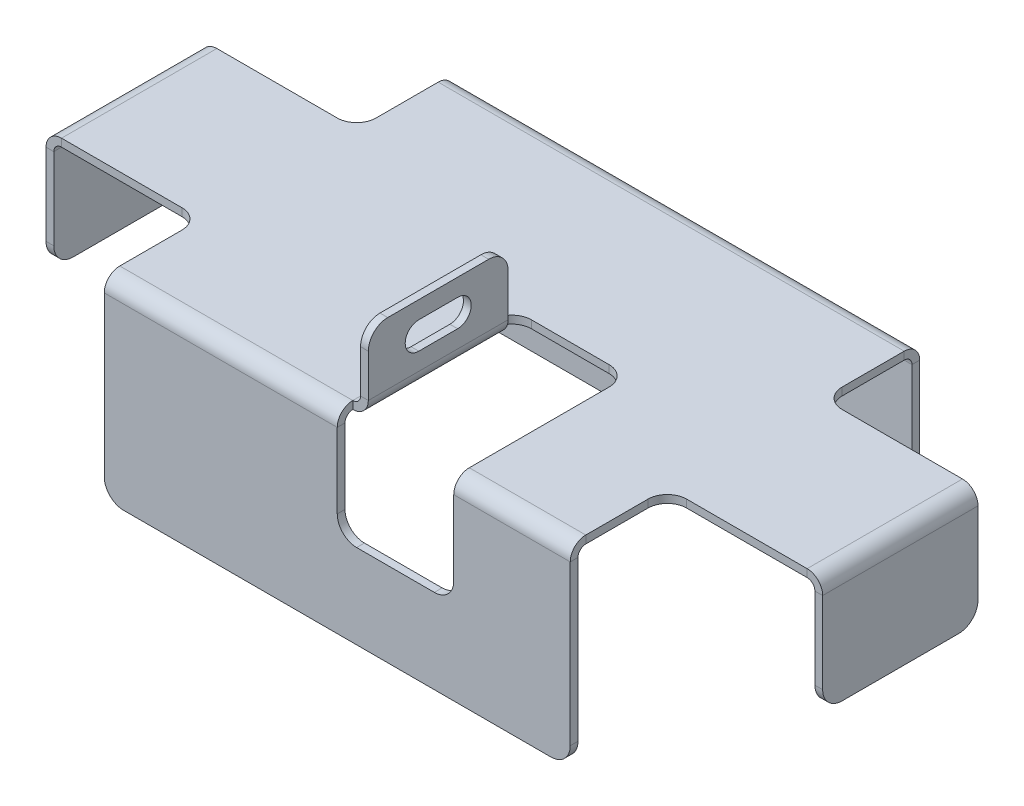
from build123d import *

# Parameters (mm, degrees)
BASE_FLANGE1_DEPTH      = 45
EDGE_FLANGE2_START      = -100
EDGE_FLANGE2_DEPTH      = 200
EDGE_FLANGE2_2_DEPTH    = 4
EDGE_FLANGE2_START_2    = 96
EDGE_FLANGE2_3_DEPTH    = 4
EDGE_FLANGE2_START_3    = -96
EDGE_FLANGE2_4_DEPTH    = 192
EDGE_FLANGE3_START      = -100
EDGE_FLANGE3_DEPTH      = 200
EDGE_FLANGE3_2_DEPTH    = 4
EDGE_FLANGE3_START_2    = 96
EDGE_FLANGE3_3_DEPTH    = 4
EDGE_FLANGE3_START_3    = -96
EDGE_FLANGE3_4_DEPTH    = 192
CUT_EXTRUDE1_DEPTH      = 121.519707932
CUT_EXTRUDE1_DEPTH_BACK = 121.519707932
CUT_EXTRUDE2_DEPTH      = 138.840487521
CUT_EXTRUDE2_DEPTH_BACK = 45
EDGE_FLANGE4_DEPTH      = 36
FILLET1_R               = 5
CUT_EXTRUDE3_DEPTH      = 10


# Read off the part's stored shape, not the designer's step: Edge-Flange2, Edge-Flange3
# Sheet-metal steps are written as plain solids
with BuildPart() as part:
    # Sketch1 → Base-Flange1 (new, symmetric)
    with BuildSketch(Plane.XY):
        with BuildLine():
            Line((-100, 0), (-100, 26))
            ThreePointArc((-100, 26), (-98.828427125, 28.828427125), (-96, 30))
            Line((-96, 30), (96, 30))
            ThreePointArc((96, 30), (98.828427125, 28.828427125), (100, 26))
            Line((100, 26), (100, 0))
            Line((100, 0), (98, 0))
            Line((98, 0), (98, 26))
            ThreePointArc((98, 26), (97.414213562, 27.414213562), (96, 28))
            Line((96, 28), (-96, 28))
            ThreePointArc((-96, 28), (-97.414213562, 27.414213562), (-98, 26))
            Line((-98, 26), (-98, 0))
            Line((-98, 0), (-100, 0))
        make_face()
    extrude(amount=BASE_FLANGE1_DEPTH, both=True)

    # Edge-Flange2 outline → Edge-Flange2 (cut)
    with BuildSketch(Plane.YZ.offset(EDGE_FLANGE2_START)):
        with BuildLine():
            Line((26, 43), (26, 41))
            Line((26, 41), (28, 41))
            ThreePointArc((28, 41), (27.414213562, 42.414213562), (26, 43))
        make_face()
        with BuildLine():
            ThreePointArc((26, 45), (28.828427125, 43.828427125), (30, 41))
            Line((30, 41), (30, 45))
            Line((30, 45), (26, 45))
        make_face()
    extrude(amount=EDGE_FLANGE2_DEPTH, mode=Mode.SUBTRACT)

    # Edge-Flange2 2 outline → Edge-Flange2 2 (cut)
    with BuildSketch(Plane.YZ.offset(EDGE_FLANGE2_START)):
        with BuildLine():
            Line((26, 45), (26, 43))
            ThreePointArc((26, 43), (27.414213562, 42.414213562), (28, 41))
            Line((28, 41), (30, 41))
            ThreePointArc((30, 41), (28.828427125, 43.828427125), (26, 45))
        make_face()
    extrude(amount=EDGE_FLANGE2_2_DEPTH, mode=Mode.SUBTRACT)

    # Edge-Flange2 3 outline → Edge-Flange2 3 (cut)
    with BuildSketch(Plane.YZ.offset(EDGE_FLANGE2_START_2)):
        with BuildLine():
            Line((26, 45), (26, 43))
            ThreePointArc((26, 43), (27.414213562, 42.414213562), (28, 41))
            Line((28, 41), (30, 41))
            ThreePointArc((30, 41), (28.828427125, 43.828427125), (26, 45))
        make_face()
    extrude(amount=EDGE_FLANGE2_3_DEPTH, mode=Mode.SUBTRACT)

    # Edge-Flange2 4 outline → Edge-Flange2 4 (add)
    with BuildSketch(Plane.YZ.offset(EDGE_FLANGE2_START_3)):
        with BuildLine():
            Line((-20, 43), (26, 43))
            ThreePointArc((26, 43), (27.414213562, 42.414213562), (28, 41))
            Line((28, 41), (28, 44.464101616))
            ThreePointArc((28, 44.464101616), (27.03527618, 44.863703305), (26, 45))
            Line((26, 45), (-20, 45))
            Line((-20, 45), (-20, 43))
        make_face()
    extrude(amount=EDGE_FLANGE2_4_DEPTH)

    # Edge-Flange3 outline → Edge-Flange3 (cut)
    with BuildSketch(Plane.YZ.offset(EDGE_FLANGE3_START)):
        with BuildLine():
            Line((28, -41), (26, -41))
            Line((26, -41), (26, -43))
            ThreePointArc((26, -43), (27.414213562, -42.414213562), (28, -41))
        make_face()
        with BuildLine():
            Line((26, -45), (30, -45))
            Line((30, -45), (30, -41))
            ThreePointArc((30, -41), (28.828427125, -43.828427125), (26, -45))
        make_face()
    extrude(amount=EDGE_FLANGE3_DEPTH, mode=Mode.SUBTRACT)

    # Edge-Flange3 2 outline → Edge-Flange3 2 (cut)
    with BuildSketch(Plane.YZ.offset(EDGE_FLANGE3_START)):
        with BuildLine():
            ThreePointArc((28, -41), (27.414213562, -42.414213562), (26, -43))
            Line((26, -43), (26, -45))
            ThreePointArc((26, -45), (28.828427125, -43.828427125), (30, -41))
            Line((30, -41), (28, -41))
        make_face()
    extrude(amount=EDGE_FLANGE3_2_DEPTH, mode=Mode.SUBTRACT)

    # Edge-Flange3 3 outline → Edge-Flange3 3 (cut)
    with BuildSketch(Plane.YZ.offset(EDGE_FLANGE3_START_2)):
        with BuildLine():
            ThreePointArc((28, -41), (27.414213562, -42.414213562), (26, -43))
            Line((26, -43), (26, -45))
            ThreePointArc((26, -45), (28.828427125, -43.828427125), (30, -41))
            Line((30, -41), (28, -41))
        make_face()
    extrude(amount=EDGE_FLANGE3_3_DEPTH, mode=Mode.SUBTRACT)

    # Edge-Flange3 4 outline → Edge-Flange3 4 (add)
    with BuildSketch(Plane.YZ.offset(EDGE_FLANGE3_START_3)):
        with BuildLine():
            ThreePointArc((28, -41), (27.414213562, -42.414213562), (26, -43))
            Line((26, -43), (-20, -43))
            Line((-20, -43), (-20, -45))
            Line((-20, -45), (26, -45))
            ThreePointArc((26, -45), (27.03527618, -44.863703305), (28, -44.464101616))
            Line((28, -44.464101616), (28, -41))
        make_face()
    extrude(amount=EDGE_FLANGE3_4_DEPTH)

    # Sketch15 → Cut-Extrude1 (cut, two sides: drawn at the far end of the back side and taken through both)
    with BuildSketch(Plane(origin=(0, 30, 0), x_dir=(1, 0, 0), z_dir=(0, 1, 0)).offset(-CUT_EXTRUDE1_DEPTH_BACK)):
        with BuildLine():
            Line((-60, 65.269806107), (-60, 25))
            ThreePointArc((-60, 25), (-61.464466094, 21.464466094), (-65, 20))
            Line((-65, 20), (-105.792448389, 20))
            Line((-105.792448389, 20), (-105.792448389, 65.269806107))
            Line((-105.792448389, 65.269806107), (-60, 65.269806107))
        make_face()
        with BuildLine():
            Line((105.792448389, 65.269806107), (60, 65.269806107))
            Line((60, 65.269806107), (60, 25))
            ThreePointArc((60, 25), (61.464466094, 21.464466094), (65, 20))
            Line((65, 20), (105.792448389, 20))
            Line((105.792448389, 20), (105.792448389, 65.269806107))
        make_face()
        with BuildLine():
            Line((60, -65.269806107), (60, -25))
            ThreePointArc((60, -25), (61.464466094, -21.464466094), (65, -20))
            Line((65, -20), (105.792448389, -20))
            Line((105.792448389, -20), (105.792448389, -65.269806107))
            Line((105.792448389, -65.269806107), (60, -65.269806107))
        make_face()
        with BuildLine():
            Line((-105.792448389, -20), (-105.792448389, -65.269806107))
            Line((-105.792448389, -65.269806107), (-60, -65.269806107))
            Line((-60, -65.269806107), (-60, -25))
            ThreePointArc((-60, -25), (-61.464466094, -21.464466094), (-65, -20))
            Line((-65, -20), (-105.792448389, -20))
        make_face()
    extrude(amount=CUT_EXTRUDE1_DEPTH + CUT_EXTRUDE1_DEPTH_BACK, mode=Mode.SUBTRACT)

    # Sketch16 → Cut-Extrude2 (cut, two sides: drawn at the far end of the back side and taken through both)
    with BuildSketch(Plane.XY.offset(45).offset(-CUT_EXTRUDE2_DEPTH_BACK)):
        with BuildLine():
            Line((0, 30), (0, 6.71))
            ThreePointArc((0, 6.71), (1.464466094, 3.174466094), (5, 1.71))
            Line((5, 1.71), (25, 1.71))
            ThreePointArc((25, 1.71), (28.535533906, 3.174466094), (30, 6.71))
            Line((30, 6.71), (30, 30))
            Line((30, 30), (0, 30))
        make_face()
    extrude(amount=CUT_EXTRUDE2_DEPTH + CUT_EXTRUDE2_DEPTH_BACK, mode=Mode.SUBTRACT)

    # Edge-Flange4 section (across the edge) → Edge-Flange4 (add)
    with BuildSketch(Plane(origin=(2, 30, 41), x_dir=(-1, 0, 0), z_dir=(0, 0, -1))):
        with BuildLine():
            Line((-2, 2), (-2, 18))
            Line((-2, 18), (0, 18))
            Line((0, 18), (0, 2))
            ThreePointArc((0, 2), (0.585786438, 0.585786438), (2, 0))
            Line((2, 0), (2, -2))
            ThreePointArc((2, -2), (-0.828427125, -0.828427125), (-2, 2))
        make_face()
    extrude(amount=EDGE_FLANGE4_DEPTH)

    # Fillet1
    fillet1_edges = [part.edges().sort_by_distance(p)[0] for p in [
        (3, 48, 5),
        (3, 48, 41),
        (-99, 0, 20),
        (-60, -20, 44),
        (60, -20, 44),
        (99, 0, -20),
        (-60, -20, -44),
        (-99, 0, -20),
        (99, 0, 20),
        (60, -20, -44),
        (0, 29, 0),
        (30, 29, 0),
    ]]
    fillet(fillet1_edges, radius=FILLET1_R - 0.0001)  # a hair under: the kernel refuses the full size

    # Sketch21 → Cut-Extrude3 (cut)
    with BuildSketch(Plane.ZY.offset(-2)):
        with BuildLine():
            Line((18, 43.5), (28, 43.5))
            ThreePointArc((28, 43.5), (31.5, 40), (28, 36.5))
            Line((28, 36.5), (18, 36.5))
            ThreePointArc((18, 36.5), (14.5, 40), (18, 43.5))
        make_face()
    extrude(amount=-CUT_EXTRUDE3_DEPTH, mode=Mode.SUBTRACT)


solid = part.part
